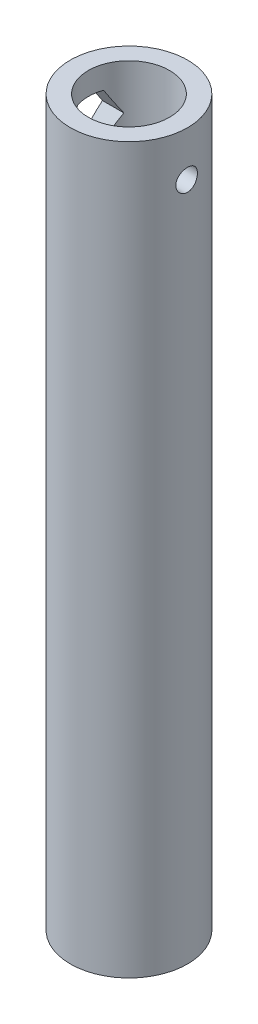
from build123d import *

# Parameters (mm, degrees)
SKETCH1_R           = 8.255
SKETCH1_R_2         = 5.715
BOSS_EXTRUDE1_DEPTH = 101.981
CUT_EXTRUDE1_DEPTH  = 103.647038004
SKETCH3_R           = 1.524
CUT_EXTRUDE2_DEPTH  = 103.647038004
SKETCH4_R           = 5.715
SKETCH4_R_2         = 5.08
BOSS_EXTRUDE2_DEPTH = 3.81


with BuildPart() as part:
    # Sketch1 → Boss-Extrude1 (new body)
    with BuildSketch(Plane(origin=(0, 0, 0), x_dir=(1, 0, 0), z_dir=(0, 1, 0))):
        Circle(SKETCH1_R)
        Circle(SKETCH1_R_2, mode=Mode.SUBTRACT)
    extrude(amount=BOSS_EXTRUDE1_DEPTH)

    # Sketch2 → Cut-Extrude1 (cut, through all)
    with BuildSketch(Plane(origin=(0, 0, 0), x_dir=(0, 0, -1), z_dir=(1, 0, 0))):
        Polygon((1.833087105, 92.456), (3.666174209, 95.631), (1.833087105, 98.806), (-1.833087105, 98.806), (-3.666174209, 95.631), (-1.833087105, 92.456), align=None)
    extrude(amount=-CUT_EXTRUDE1_DEPTH, mode=Mode.SUBTRACT)

    # Sketch3 → Cut-Extrude2 (cut, through all)
    with BuildSketch(Plane(origin=(0, 0, 0), x_dir=(0, 0, -1), z_dir=(1, 0, 0))):
        with Locations((0, 95.631)):
            Circle(SKETCH3_R)
    extrude(amount=CUT_EXTRUDE2_DEPTH, mode=Mode.SUBTRACT)

    # Sketch4 → Boss-Extrude2 (add)
    with BuildSketch(Plane.XZ):
        Circle(SKETCH4_R)
        Circle(SKETCH4_R_2, mode=Mode.SUBTRACT)
    extrude(amount=-BOSS_EXTRUDE2_DEPTH)


solid = part.part
